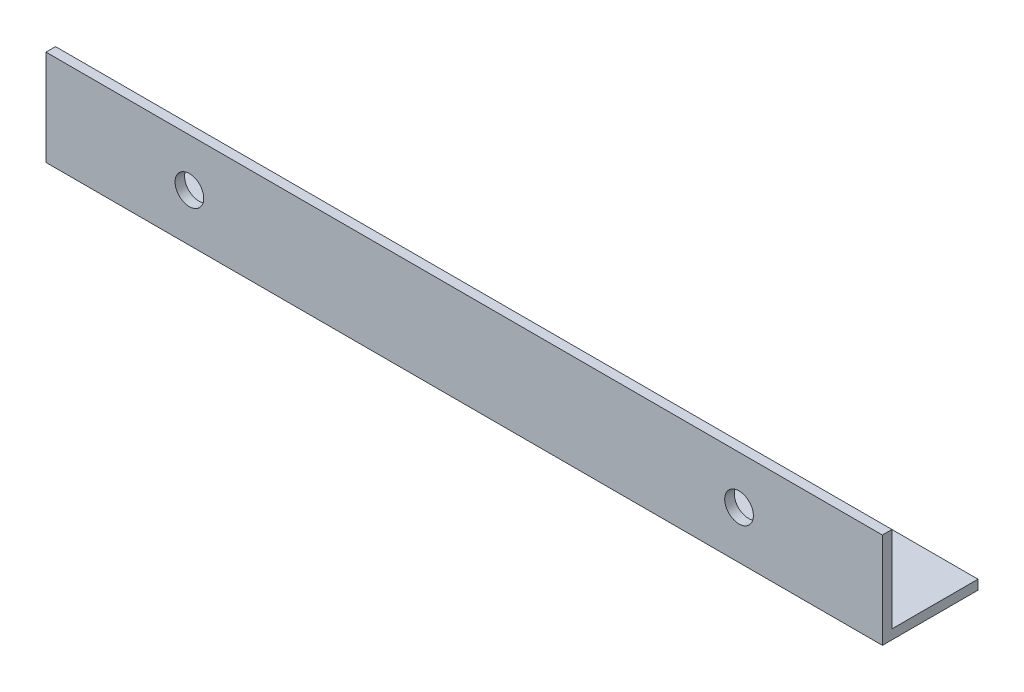
from build123d import *

# Parameters (mm, degrees)
EXTRUDE_1_DEPTH     = 350
SKETCH_2_R          = 6
CUT_EXTRUDE_1_DEPTH = 355.541958025
SKETCH_3_R          = 6
CUT_EXTRUDE_2_DEPTH = 355.541958025


with BuildPart() as part:
    # Эскиз1 → Бобышка-Вытянуть1 (new body)
    with BuildSketch(Plane(origin=(0, 0, 0), x_dir=(0, 0, -1), z_dir=(1, 0, 0))):
        Polygon((0, 0), (0, 40), (4, 40), (4, 4), (40, 4), (40, 0), align=None)
    extrude(amount=EXTRUDE_1_DEPTH)

    # Эскиз2 → Вырез-Вытянуть1 (cut, through all)
    with BuildSketch(Plane.XY):
        with Locations((60, 20)):
            Circle(SKETCH_2_R)
    extrude(amount=-CUT_EXTRUDE_1_DEPTH, mode=Mode.SUBTRACT)

    # Эскиз3 → Вырез-Вытянуть2 (cut, through all)
    with BuildSketch(Plane.XY):
        with Locations((290, 20)):
            Circle(SKETCH_3_R)
    extrude(amount=-CUT_EXTRUDE_2_DEPTH, mode=Mode.SUBTRACT)


solid = part.part
